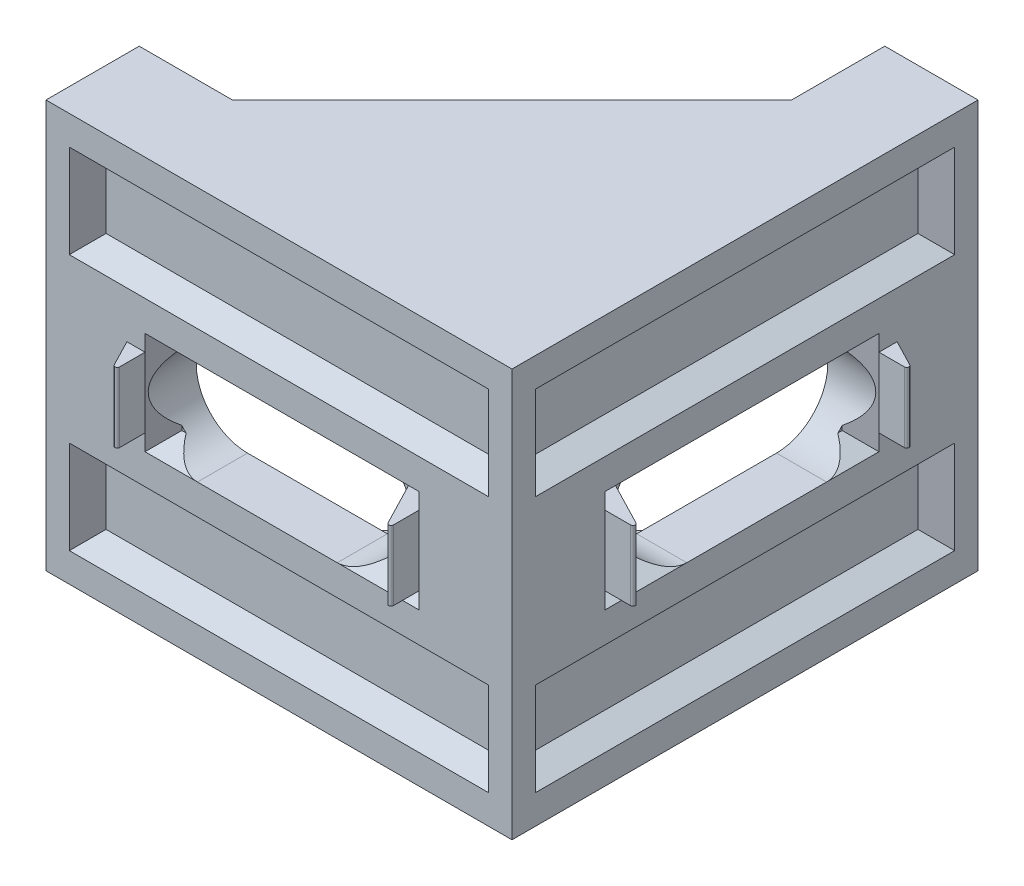
from build123d import *

# Parameters (mm, degrees)
EXTRUDE_1_DEPTH               = 3
SKETCH_2_W                    = 40
SKETCH_2_H                    = 29
EXTRUDE_2_DEPTH               = 4.3
EXTRUDE_3_DEPTH               = 3
SKETCH_4_W                    = 35.7
SKETCH_4_H                    = 29
EXTRUDE_4_DEPTH               = 4.3
SKETCH_5_W                    = 36
SKETCH_5_H                    = 8
CUT_EXTRUDE_1_DEPTH           = 2
CUT_EXTRUDE_1_DRAFT           = -30
CUT_EXTRUDE_1_PROFILE_2_DEPTH = 2
CUT_EXTRUDE_1_PROFILE_2_DRAFT = -30
SKETCH_5_W_2                  = 23.5
SKETCH_5_H_2                  = 8.8
CUT_EXTRUDE_1_PROFILE_3_DEPTH = 2
CUT_EXTRUDE_1_PROFILE_3_DRAFT = -30
SKETCH_6_W                    = 36
SKETCH_6_H                    = 8
CUT_EXTRUDE_2_DEPTH           = 2
CUT_EXTRUDE_2_DRAFT           = -30
CUT_EXTRUDE_2_PROFILE_2_DEPTH = 2
CUT_EXTRUDE_2_PROFILE_2_DRAFT = -30
SKETCH_6_W_2                  = 23.5
SKETCH_6_H_2                  = 8.8
CUT_EXTRUDE_2_PROFILE_3_DEPTH = 2
CUT_EXTRUDE_2_PROFILE_3_DRAFT = -30
EXTRUDE_5_DEPTH               = 3
EXTRUDE_6_DEPTH               = 3
FILLET_2_R                    = 0.2


with BuildPart() as part:
    # 草图1 → 凸台-拉伸1 (new body)
    with BuildSketch(Plane(origin=(0, 0, 0), x_dir=(1, 0, 0), z_dir=(0, 1, 0))):
        Polygon((0, 0), (0, 40), (-8, 40), (-8, 32), (-32, 8), (-40, 8), (-40, 0), align=None)
    extrude(amount=EXTRUDE_1_DEPTH)

    # 草图2 → 凸台-拉伸2 (add)
    with BuildSketch(Plane(origin=(0, 0, 0), x_dir=(0, 0, -1), z_dir=(1, 0, 0))):
        with Locations((20, 17.5)):
            Rectangle(SKETCH_2_W, SKETCH_2_H)
        with BuildLine():
            Line((27, 13.1), (15, 13.1))
            ThreePointArc((15, 13.1), (10.6, 17.5), (15, 21.9))
            Line((15, 21.9), (27, 21.9))
            ThreePointArc((27, 21.9), (31.4, 17.5), (27, 13.1))
        make_face(mode=Mode.SUBTRACT)
    extrude(amount=-EXTRUDE_2_DEPTH)

    # 草图3 → 凸台-拉伸3 (add)
    with BuildSketch(Plane(origin=(0, 32, 0), x_dir=(1, 0, 0), z_dir=(0, 1, 0))):
        Polygon((-4.3, 40), (0, 40), (0, 0), (-4.3, 0), (-40, 0), (-40, 8), (-32, 8), (-8, 32), (-8, 40), align=None)
    extrude(amount=EXTRUDE_3_DEPTH)

    # 草图4 → 凸台-拉伸4 (add)
    with BuildSketch(Plane.XY):
        with Locations((-22.15, 17.5)):
            Rectangle(SKETCH_4_W, SKETCH_4_H)
        with BuildLine():
            Line((-27, 21.9), (-15, 21.9))
            ThreePointArc((-15, 21.9), (-10.6, 17.5), (-15, 13.1))
            Line((-15, 13.1), (-27, 13.1))
            ThreePointArc((-27, 13.1), (-31.4, 17.5), (-27, 21.9))
        make_face(mode=Mode.SUBTRACT)
    extrude(amount=-EXTRUDE_4_DEPTH)


with BuildPart() as cut_extrude_1_tool:
    # 草图5 → 切除-拉伸1 (with draft: the straight prism first)
    with BuildSketch(Plane(origin=(0, 0, 0), x_dir=(0, 0, -1), z_dir=(1, 0, 0))):
        with Locations((20, 28.5)):
            Rectangle(SKETCH_5_W, SKETCH_5_H)
    extrude(amount=-CUT_EXTRUDE_1_DEPTH)
    # 切除-拉伸1: the draft: its side faces are tilted about the plane it starts from
    cut_extrude_1_sides = [cut_extrude_1_tool.faces().sort_by_distance(p)[0] for p in [
        (-1, 32.5, -20),
        (-1, 28.5, -2),
        (-1, 24.5, -20),
        (-1, 28.5, -38),
    ]]
    draft(cut_extrude_1_sides, Plane(origin=(0, 0, 0), x_dir=(0, 0, -1), z_dir=(1, 0, 0)), CUT_EXTRUDE_1_DRAFT)


with BuildPart() as part_1:
    add(part.part)

    # 切除-拉伸1: cut by cut_extrude_1_tool
    add(cut_extrude_1_tool.part, mode=Mode.SUBTRACT)


with BuildPart() as cut_extrude_1_profile_2_tool:
    # 草图5 → 切除-拉伸1 profile 2 (with draft: the straight prism first)
    with BuildSketch(Plane(origin=(0, 0, 0), x_dir=(0, 0, -1), z_dir=(1, 0, 0))):
        with Locations((20, 6.5)):
            Rectangle(SKETCH_5_W, SKETCH_5_H)
    extrude(amount=-CUT_EXTRUDE_1_PROFILE_2_DEPTH)
    # 切除-拉伸1 profile 2: the draft: its side faces are tilted about the plane it starts from
    cut_extrude_1_profile_2_sides = [cut_extrude_1_profile_2_tool.faces().sort_by_distance(p)[0] for p in [
        (-1, 10.5, -20),
        (-1, 6.5, -2),
        (-1, 2.5, -20),
        (-1, 6.5, -38),
    ]]
    draft(cut_extrude_1_profile_2_sides, Plane(origin=(0, 0, 0), x_dir=(0, 0, -1), z_dir=(1, 0, 0)), CUT_EXTRUDE_1_PROFILE_2_DRAFT)


with BuildPart() as part_2:
    add(part_1.part)

    # 切除-拉伸1 profile 2: cut by cut_extrude_1_profile_2_tool
    add(cut_extrude_1_profile_2_tool.part, mode=Mode.SUBTRACT)


with BuildPart() as cut_extrude_1_profile_3_tool:
    # 草图5 → 切除-拉伸1 profile 3 (with draft: the straight prism first)
    with BuildSketch(Plane(origin=(0, 0, 0), x_dir=(0, 0, -1), z_dir=(1, 0, 0))):
        with Locations((19.75, 17.5)):
            Rectangle(SKETCH_5_W_2, SKETCH_5_H_2)
    extrude(amount=-CUT_EXTRUDE_1_PROFILE_3_DEPTH)
    # 切除-拉伸1 profile 3: the draft: its side faces are tilted about the plane it starts from
    cut_extrude_1_profile_3_sides = [cut_extrude_1_profile_3_tool.faces().sort_by_distance(p)[0] for p in [
        (-1, 21.9, -19.75),
        (-1, 17.5, -8),
        (-1, 13.1, -19.75),
        (-1, 17.5, -31.5),
    ]]
    draft(cut_extrude_1_profile_3_sides, Plane(origin=(0, 0, 0), x_dir=(0, 0, -1), z_dir=(1, 0, 0)), CUT_EXTRUDE_1_PROFILE_3_DRAFT)


with BuildPart() as part_3:
    add(part_2.part)

    # 切除-拉伸1 profile 3: cut by cut_extrude_1_profile_3_tool
    add(cut_extrude_1_profile_3_tool.part, mode=Mode.SUBTRACT)


with BuildPart() as cut_extrude_2_tool:
    # 草图6 → 切除-拉伸2 (with draft: the straight prism first)
    with BuildSketch(Plane.XY):
        with Locations((-20, 6.5)):
            Rectangle(SKETCH_6_W, SKETCH_6_H)
    extrude(amount=-CUT_EXTRUDE_2_DEPTH)
    # 切除-拉伸2: the draft: its side faces are tilted about the plane it starts from
    cut_extrude_2_sides = [cut_extrude_2_tool.faces().sort_by_distance(p)[0] for p in [
        (-20, 2.5, -1),
        (-2, 6.5, -1),
        (-20, 10.5, -1),
        (-38, 6.5, -1),
    ]]
    draft(cut_extrude_2_sides, Plane.XY, CUT_EXTRUDE_2_DRAFT)


with BuildPart() as part_4:
    add(part_3.part)

    # 切除-拉伸2: cut by cut_extrude_2_tool
    add(cut_extrude_2_tool.part, mode=Mode.SUBTRACT)


with BuildPart() as cut_extrude_2_profile_2_tool:
    # 草图6 → 切除-拉伸2 profile 2 (with draft: the straight prism first)
    with BuildSketch(Plane.XY):
        with Locations((-20, 28.5)):
            Rectangle(SKETCH_6_W, SKETCH_6_H)
    extrude(amount=-CUT_EXTRUDE_2_PROFILE_2_DEPTH)
    # 切除-拉伸2 profile 2: the draft: its side faces are tilted about the plane it starts from
    cut_extrude_2_profile_2_sides = [cut_extrude_2_profile_2_tool.faces().sort_by_distance(p)[0] for p in [
        (-20, 24.5, -1),
        (-2, 28.5, -1),
        (-20, 32.5, -1),
        (-38, 28.5, -1),
    ]]
    draft(cut_extrude_2_profile_2_sides, Plane.XY, CUT_EXTRUDE_2_PROFILE_2_DRAFT)


with BuildPart() as part_5:
    add(part_4.part)

    # 切除-拉伸2 profile 2: cut by cut_extrude_2_profile_2_tool
    add(cut_extrude_2_profile_2_tool.part, mode=Mode.SUBTRACT)


with BuildPart() as cut_extrude_2_profile_3_tool:
    # 草图6 → 切除-拉伸2 profile 3 (with draft: the straight prism first)
    with BuildSketch(Plane.XY):
        with Locations((-19.75, 17.5)):
            Rectangle(SKETCH_6_W_2, SKETCH_6_H_2)
    extrude(amount=-CUT_EXTRUDE_2_PROFILE_3_DEPTH)
    # 切除-拉伸2 profile 3: the draft: its side faces are tilted about the plane it starts from
    cut_extrude_2_profile_3_sides = [cut_extrude_2_profile_3_tool.faces().sort_by_distance(p)[0] for p in [
        (-19.75, 13.1, -1),
        (-8, 17.5, -1),
        (-19.75, 21.9, -1),
        (-31.5, 17.5, -1),
    ]]
    draft(cut_extrude_2_profile_3_sides, Plane.XY, CUT_EXTRUDE_2_PROFILE_3_DRAFT)


with BuildPart() as part_6:
    add(part_5.part)

    # 切除-拉伸2 profile 3: cut by cut_extrude_2_profile_3_tool
    add(cut_extrude_2_profile_3_tool.part, mode=Mode.SUBTRACT)

    # 草图7 → 凸台-拉伸5 (add, symmetric)
    with BuildSketch(Plane(origin=(0, 17.5, 0), x_dir=(1, 0, 0), z_dir=(0, 1, 0))):
        Polygon((-2, 8), (3, 8), (-2, 10.591750104), align=None)
        Polygon((-2, 34.091750104), (-2, 31.5), (3, 31.5), align=None)
    extrude(amount=EXTRUDE_5_DEPTH, both=True)

    # 草图8 → 凸台-拉伸6 (add, symmetric)
    with BuildSketch(Plane(origin=(0, 17.5, 0), x_dir=(1, 0, 0), z_dir=(0, 1, 0))):
        Polygon((-8, -3), (-8, 0), (-9.154700538, 2), (-10.591750104, 2), align=None)
        Polygon((-31.5, -3), (-31.5, 2), (-34.091750104, 2), align=None)
    extrude(amount=EXTRUDE_6_DEPTH, both=True)

    # 圆角2
    fillet_2_edges = [part_6.edges().sort_by_distance(p)[0] for p in [
        (3, 17.5, -31.5),
        (3, 17.5, -8),
        (-31.5, 17.5, 3),
        (-8, 17.5, 3),
    ]]
    fillet(fillet_2_edges, radius=FILLET_2_R)


solid = part_6.part
